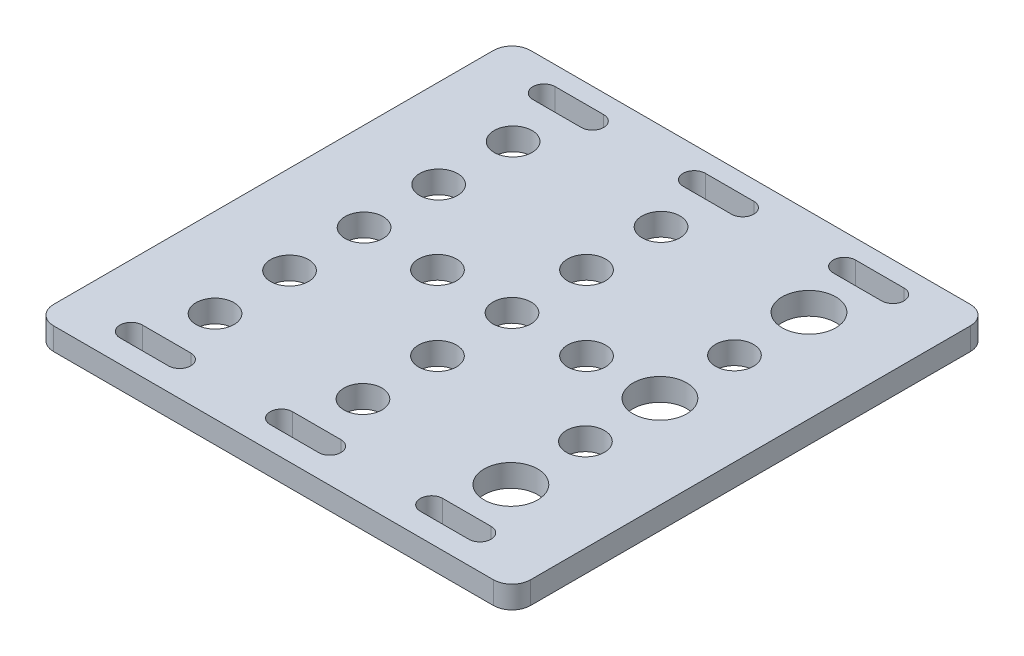
from build123d import *

# Parameters (mm, degrees)
SKETCH1_R           = 2.55
SKETCH1_R_2         = 3.6
BOSS_EXTRUDE1_DEPTH = 3


with BuildPart() as part:
    # Sketch1 → Boss-Extrude1 (new body)
    with BuildSketch(Plane(origin=(0, 0, 0), x_dir=(1, 0, 0), z_dir=(0, 1, 0))):
        with BuildLine():
            Line((29.5, 32), (-29.5, 32))
            ThreePointArc((-29.5, 32), (-31.267766953, 31.267766953), (-32, 29.5))
            Line((-32, 29.5), (-32, -29.5))
            ThreePointArc((-32, -29.5), (-31.267766953, -31.267766953), (-29.5, -32))
            Line((-29.5, -32), (29.5, -32))
            ThreePointArc((29.5, -32), (31.267766953, -31.267766953), (32, -29.5))
            Line((32, -29.5), (32, 29.5))
            ThreePointArc((32, 29.5), (31.267766953, 31.267766953), (29.5, 32))
        make_face()
        with Locations((-10.25, 0.25)):
            Circle(SKETCH1_R, mode=Mode.SUBTRACT)
        with Locations((19.6, 0.25)):
            Circle(SKETCH1_R_2, mode=Mode.SUBTRACT)
        with Locations((19.6, 10.25)):
            Circle(SKETCH1_R, mode=Mode.SUBTRACT)
        with Locations((-0.25, 10.25)):
            Circle(SKETCH1_R, mode=Mode.SUBTRACT)
        with Locations((19.6, -19.75)):
            Circle(SKETCH1_R_2, mode=Mode.SUBTRACT)
        with Locations((-0.25, -9.75)):
            Circle(SKETCH1_R, mode=Mode.SUBTRACT)
        with Locations((19.6, -9.75)):
            Circle(SKETCH1_R, mode=Mode.SUBTRACT)
        with Locations((9.75, 0.25)):
            Circle(SKETCH1_R, mode=Mode.SUBTRACT)
        with Locations((-0.25, 0.25)):
            Circle(SKETCH1_R, mode=Mode.SUBTRACT)
        with Locations((-20.1, -19.75)):
            Circle(SKETCH1_R, mode=Mode.SUBTRACT)
        with Locations((-20.1, -9.75)):
            Circle(SKETCH1_R, mode=Mode.SUBTRACT)
        with Locations((-20.1, 0.25)):
            Circle(SKETCH1_R, mode=Mode.SUBTRACT)
        with Locations((-20.1, 10.25)):
            Circle(SKETCH1_R, mode=Mode.SUBTRACT)
        with Locations((19.6, 20.25)):
            Circle(SKETCH1_R_2, mode=Mode.SUBTRACT)
        with Locations((-20.1, 20.25)):
            Circle(SKETCH1_R, mode=Mode.SUBTRACT)
        with Locations((-0.25, -19.75)):
            Circle(SKETCH1_R, mode=Mode.SUBTRACT)
        with Locations((-0.25, 20.25)):
            Circle(SKETCH1_R, mode=Mode.SUBTRACT)
        with BuildLine():
            Line((3, 26.45), (-3.500000052, 26.45))
            ThreePointArc((-3.500000052, 26.45), (-5.000000052, 27.95), (-3.500000052, 29.45))
            Line((-3.500000052, 29.45), (3, 29.45))
            ThreePointArc((3, 29.45), (4.5, 27.95), (3, 26.45))
        make_face(mode=Mode.SUBTRACT)
        with BuildLine():
            Line((-23.649999471, 29.45), (-17.15, 29.45))
            ThreePointArc((-17.15, 29.45), (-15.65, 27.95), (-17.15, 26.45))
            Line((-17.15, 26.45), (-23.649999471, 26.45))
            ThreePointArc((-23.649999471, 26.45), (-25.149999471, 27.95), (-23.649999471, 29.45))
        make_face(mode=Mode.SUBTRACT)
        with BuildLine():
            Line((16.649999628, 29.45), (23.15, 29.45))
            ThreePointArc((23.15, 29.45), (24.65, 27.95), (23.15, 26.45))
            Line((23.15, 26.45), (16.649999628, 26.45))
            ThreePointArc((16.649999628, 26.45), (15.149999628, 27.95), (16.649999628, 29.45))
        make_face(mode=Mode.SUBTRACT)
        with BuildLine():
            Line((-17.15, -28.95), (-23.649999471, -28.95))
            ThreePointArc((-23.649999471, -28.95), (-25.149999471, -27.45), (-23.649999471, -25.95))
            Line((-23.649999471, -25.95), (-17.15, -25.95))
            ThreePointArc((-17.15, -25.95), (-15.65, -27.45), (-17.15, -28.95))
        make_face(mode=Mode.SUBTRACT)
        with BuildLine():
            Line((-3.500000052, -25.95), (3, -25.95))
            ThreePointArc((3, -25.95), (4.5, -27.45), (3, -28.95))
            Line((3, -28.95), (-3.500000052, -28.95))
            ThreePointArc((-3.500000052, -28.95), (-5.000000052, -27.45), (-3.500000052, -25.95))
        make_face(mode=Mode.SUBTRACT)
        with BuildLine():
            Line((23.15, -28.95), (16.649999628, -28.95))
            ThreePointArc((16.649999628, -28.95), (15.149999628, -27.45), (16.649999628, -25.95))
            Line((16.649999628, -25.95), (23.15, -25.95))
            ThreePointArc((23.15, -25.95), (24.65, -27.45), (23.15, -28.95))
        make_face(mode=Mode.SUBTRACT)
    extrude(amount=BOSS_EXTRUDE1_DEPTH)


solid = part.part
